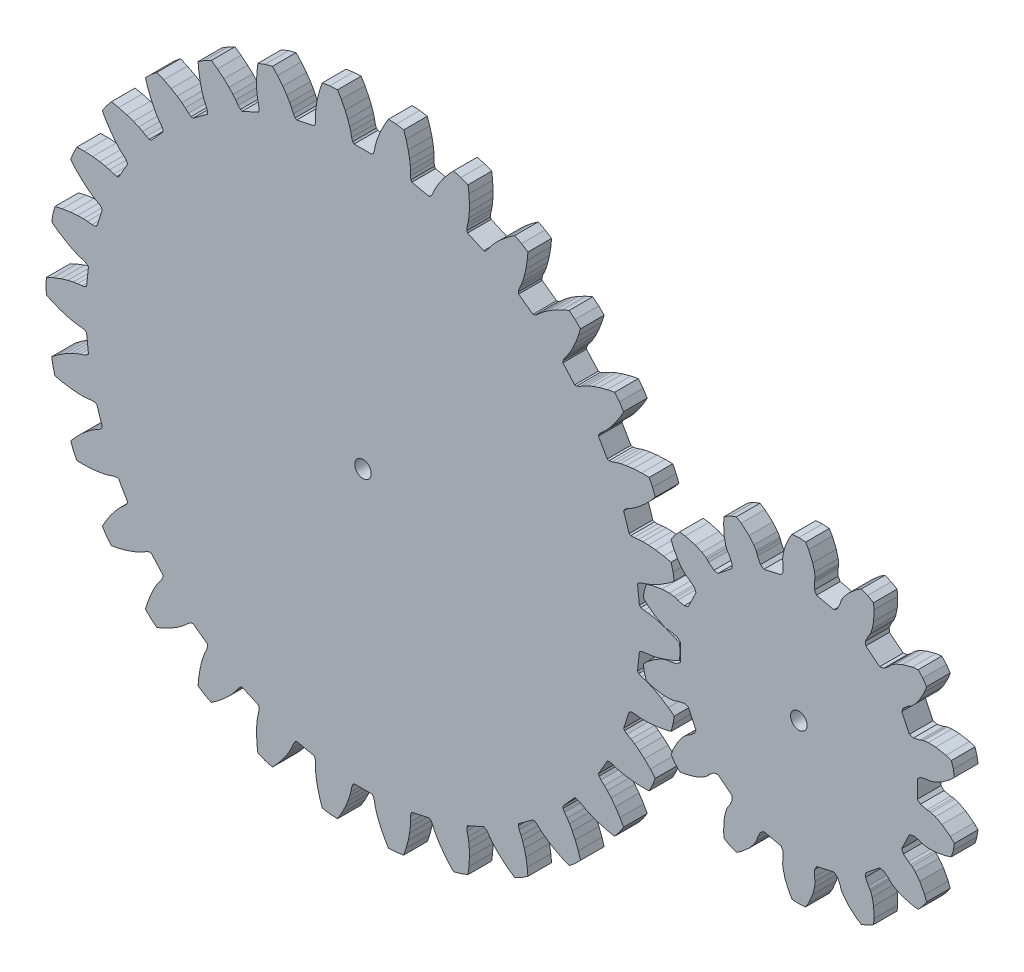
from build123d import *

# Parameters (mm, degrees)
MODEL_R             = 1.0795
BOSS_EXTRUDE1_DEPTH = 3.0988
MODEL_3_R           = 1.0795
BOSS_EXTRUDE2_DEPTH = 3.0988


with BuildPart() as part:
    # Model → Boss-Extrude1 (new body)
    with BuildSketch(Plane.XY):
        Polygon((39.441516503, -9.830019704), (40.395372889, -9.61187767), (40.655367359, -8.641565099), (40.81251227, -7.64939118), (40.02984746, -7.062140171), (39.103037375, -6.462979173), (38.294098274, -6.016757454), (37.619084961, -5.703688413), (37.091838369, -5.502545226), (36.525459945, -5.330663653), (36.159575727, -5.146889483), (35.996816225, -4.951285302), (36.239629524, -2.641071087), (36.439500736, -2.48358093), (36.835598304, -2.379894273), (37.42533619, -2.32952542), (37.982881199, -2.242398425), (38.708234565, -2.076513853), (39.592271118, -1.808231045), (40.623400754, -1.414857804), (41.511058811, -1.003164803), (41.563632451, 0), (41.511058811, 1.003164803), (40.623400754, 1.414857804), (39.592271118, 1.808231045), (38.708234565, 2.076513853), (37.982881199, 2.242398425), (37.42533619, 2.32952542), (36.835598304, 2.379894273), (36.439500736, 2.48358093), (36.239629524, 2.641071087), (35.996816225, 4.951285302), (36.159575727, 5.146889483), (36.525459945, 5.330663653), (37.091838369, 5.502545226), (37.619084961, 5.703688413), (38.294098274, 6.016757454), (39.103037375, 6.462979173), (40.02984746, 7.062140171), (40.81251227, 7.64939118), (40.655367359, 8.641565099), (40.395372889, 9.61187767), (39.441516503, 9.830019704), (38.351132627, 10.00041289), (37.430635262, 10.07903154), (36.686643265, 10.090481691), (36.123167232, 10.059784627), (35.535844261, 9.986439399), (35.126844706, 10.005506938), (34.898597115, 10.117999996), (34.180769326, 12.327246764), (34.299303746, 12.552416128), (34.618983718, 12.808245998), (35.137249226, 13.094128242), (35.611154195, 13.400496698), (36.206326134, 13.847067588), (36.904813263, 14.451726188), (37.686797747, 15.230488733), (38.330263103, 15.967632062), (37.970267628, 16.905452337), (37.514215334, 17.800505361), (36.53584872, 17.815562573), (35.433865612, 17.755528704), (34.517137586, 17.641047184), (33.78702298, 17.497562488), (33.242242528, 17.350382973), (32.683003303, 17.156529202), (32.278977006, 17.090144282), (32.03232855, 17.152723753), (30.870858789, 19.16444839), (30.939987605, 19.409341954), (31.199491782, 19.726046531), (31.646993684, 20.113435021), (32.046845109, 20.511638974), (32.536163804, 21.072194423), (33.093671721, 21.808863422), (33.696654131, 22.733191853), (34.17279751, 23.588010802), (33.625685, 24.430490186), (32.993506556, 25.21116555), (32.033389028, 25.022479869), (30.967968639, 24.734642713), (30.095075366, 24.432064416), (29.410747661, 24.139915842), (28.908472311, 23.882686328), (28.401758271, 23.576796354), (28.020363119, 23.427860313), (27.766093519, 23.437791175), (26.211743589, 25.16407166), (26.22844554, 25.417986401), (26.416432343, 25.781724175), (26.773612659, 26.253688174), (27.081935114, 26.726324202), (27.44401499, 27.376365247), (27.836177925, 28.212848674), (28.233805035, 29.242345404), (28.521816685, 30.177480282), (27.811498584, 30.887798384), (27.03082322, 31.519976829), (26.130916523, 31.135794724), (25.148622835, 30.632734146), (24.357713941, 30.155283194), (23.749081542, 29.727239037), (23.311263136, 29.371201688), (22.879220115, 28.966644371), (22.537124906, 28.741666428), (22.286346965, 28.698514655), (20.407049416, 30.063904248), (20.370594546, 30.315742874), (20.478848051, 30.710616759), (20.730096287, 31.246529176), (20.9334146, 31.772940815), (21.15243103, 32.484057542), (21.36210958, 33.383797059), (21.537003178, 34.473468139), (21.624295609, 35.448049067), (20.781816225, 35.995161576), (19.886763202, 36.45121387), (19.086397576, 35.888325943), (18.230161538, 35.192028104), (17.555803534, 34.560571395), (17.049466598, 34.015339239), (16.695239903, 33.576054595), (16.356750254, 33.090511031), (16.06890619, 32.799323804), (15.832580107, 32.704975335), (13.71046926, 33.649799957), (13.622450821, 33.888555911), (13.64623983, 34.297308024), (13.780575233, 34.873746914), (13.87000342, 35.43092745), (13.936384334, 36.172040648), (13.95441454, 37.095713319), (13.898930936, 38.197934895), (13.78168905, 39.169368008), (12.843868775, 39.529363483), (11.873556204, 39.789357953), (11.207711469, 39.072365107), (10.514954703, 38.213261564), (9.986620272, 37.455396787), (9.604708152, 36.816805893), (9.349554572, 36.313472801), (9.119411918, 35.768163574), (8.898399167, 35.42349334), (8.686853526, 35.282071656), (6.414675807, 35.765037939), (6.278940628, 35.98027644), (6.217225447, 36.385042352), (6.228776915, 36.97681457), (6.200406534, 37.54041254), (6.111250768, 38.279132004), (5.936844624, 39.186368902), (5.653408718, 40.252968602), (5.336756548, 41.178797612), (4.344582628, 41.335942523), (3.341417825, 41.388516163), (2.839194589, 40.548754426), (2.340193891, 39.564392126), (1.980973782, 38.713241608), (1.740177871, 38.009201463), (1.595248843, 37.463817994), (1.483511521, 36.882575734), (1.338989401, 36.499486236), (1.16146976, 36.317172143), (-1.16146976, 36.317172143), (-1.338989401, 36.499486236), (-1.483511521, 36.882575734), (-1.595248843, 37.463817994), (-1.740177871, 38.009201463), (-1.980973782, 38.713241608), (-2.340193891, 39.564392126), (-2.839194589, 40.548754426), (-3.341417825, 41.388516163), (-4.344582628, 41.335942523), (-5.336756548, 41.178797612), (-5.653408718, 40.252968602), (-5.936844624, 39.186368902), (-6.111250768, 38.279132004), (-6.200406534, 37.54041254), (-6.228776915, 36.97681457), (-6.217225447, 36.385042352), (-6.278940628, 35.98027644), (-6.414675807, 35.765037939), (-8.686853526, 35.282071656), (-8.898399167, 35.42349334), (-9.119411918, 35.768163574), (-9.349554572, 36.313472801), (-9.604708152, 36.816805893), (-9.986620272, 37.455396787), (-10.514954703, 38.213261564), (-11.207711469, 39.072365107), (-11.873556204, 39.789357953), (-12.843868775, 39.529363483), (-13.78168905, 39.169368008), (-13.898930936, 38.197934895), (-13.95441454, 37.095713319), (-13.936384334, 36.172040648), (-13.87000342, 35.43092745), (-13.780575233, 34.873746914), (-13.64623983, 34.297308024), (-13.622450821, 33.888555911), (-13.71046926, 33.649799957), (-15.832580107, 32.704975335), (-16.06890619, 32.799323804), (-16.356750254, 33.090511031), (-16.695239903, 33.576054595), (-17.049466598, 34.015339239), (-17.555803534, 34.560571395), (-18.230161538, 35.192028104), (-19.086397576, 35.888325943), (-19.886763202, 36.45121387), (-20.781816225, 35.995161576), (-21.624295609, 35.448049067), (-21.537003178, 34.473468139), (-21.36210958, 33.383797059), (-21.15243103, 32.484057542), (-20.9334146, 31.772940815), (-20.730096287, 31.246529176), (-20.478848051, 30.710616759), (-20.370594546, 30.315742874), (-20.407049416, 30.063904248), (-22.286346965, 28.698514655), (-22.537124906, 28.741666428), (-22.879220115, 28.966644371), (-23.311263136, 29.371201688), (-23.749081542, 29.727239037), (-24.357713941, 30.155283194), (-25.148622835, 30.632734146), (-26.130916523, 31.135794724), (-27.03082322, 31.519976829), (-27.811498584, 30.887798384), (-28.521816685, 30.177480282), (-28.233805035, 29.242345404), (-27.836177925, 28.212848674), (-27.44401499, 27.376365247), (-27.081935114, 26.726324202), (-26.773612659, 26.253688174), (-26.416432343, 25.781724175), (-26.22844554, 25.417986401), (-26.211743589, 25.16407166), (-27.766093519, 23.437791175), (-28.020363119, 23.427860313), (-28.401758271, 23.576796354), (-28.908472311, 23.882686328), (-29.410747661, 24.139915842), (-30.095075366, 24.432064416), (-30.967968639, 24.734642713), (-32.033389028, 25.022479869), (-32.993506556, 25.21116555), (-33.625685, 24.430490186), (-34.17279751, 23.588010802), (-33.696654131, 22.733191853), (-33.093671721, 21.808863422), (-32.536163804, 21.072194423), (-32.046845109, 20.511638974), (-31.646993684, 20.113435021), (-31.199491782, 19.726046531), (-30.939987605, 19.409341954), (-30.870858789, 19.16444839), (-32.03232855, 17.152723753), (-32.278977006, 17.090144282), (-32.683003303, 17.156529202), (-33.242242528, 17.350382973), (-33.78702298, 17.497562488), (-34.517137586, 17.641047184), (-35.433865612, 17.755528704), (-36.53584872, 17.815562573), (-37.514215334, 17.800505361), (-37.970267628, 16.905452337), (-38.330263103, 15.967632062), (-37.686797747, 15.230488733), (-36.904813263, 14.451726188), (-36.206326134, 13.847067588), (-35.611154195, 13.400496698), (-35.137249226, 13.094128242), (-34.618983718, 12.808245998), (-34.299303746, 12.552416128), (-34.180769326, 12.327246764), (-34.898597115, 10.117999996), (-35.126844706, 10.005506938), (-35.535844261, 9.986439399), (-36.123167232, 10.059784627), (-36.686643265, 10.090481691), (-37.430635262, 10.07903154), (-38.351132627, 10.00041289), (-39.441516503, 9.830019704), (-40.395372889, 9.61187767), (-40.655367359, 8.641565099), (-40.81251227, 7.64939118), (-40.02984746, 7.062140171), (-39.103037375, 6.462979173), (-38.294098274, 6.016757454), (-37.619084961, 5.703688413), (-37.091838369, 5.502545226), (-36.525459945, 5.330663653), (-36.159575727, 5.146889483), (-35.996816225, 4.951285302), (-36.239629524, 2.641071087), (-36.439500736, 2.48358093), (-36.835598304, 2.379894273), (-37.42533619, 2.32952542), (-37.982881199, 2.242398425), (-38.708234565, 2.076513853), (-39.592271118, 1.808231045), (-40.623400754, 1.414857804), (-41.511058811, 1.003164803), (-41.563632451, 0), (-41.511058811, -1.003164803), (-40.623400754, -1.414857804), (-39.592271118, -1.808231045), (-38.708234565, -2.076513853), (-37.982881199, -2.242398425), (-37.42533619, -2.32952542), (-36.835598304, -2.379894273), (-36.439500736, -2.48358093), (-36.239629524, -2.641071087), (-35.996816225, -4.951285302), (-36.159575727, -5.146889483), (-36.525459945, -5.330663653), (-37.091838369, -5.502545226), (-37.619084961, -5.703688413), (-38.294098274, -6.016757454), (-39.103037375, -6.462979173), (-40.02984746, -7.062140171), (-40.81251227, -7.64939118), (-40.655367359, -8.641565099), (-40.395372889, -9.61187767), (-39.441516503, -9.830019704), (-38.351132627, -10.00041289), (-37.430635262, -10.07903154), (-36.686643265, -10.090481691), (-36.123167232, -10.059784627), (-35.535844261, -9.986439399), (-35.126844706, -10.005506938), (-34.898597115, -10.117999996), (-34.180769326, -12.327246764), (-34.299303746, -12.552416128), (-34.618983718, -12.808245998), (-35.137249226, -13.094128242), (-35.611154195, -13.400496698), (-36.206326134, -13.847067588), (-36.904813263, -14.451726188), (-37.686797747, -15.230488733), (-38.330263103, -15.967632062), (-37.970267628, -16.905452337), (-37.514215334, -17.800505361), (-36.53584872, -17.815562573), (-35.433865612, -17.755528704), (-34.517137586, -17.641047184), (-33.78702298, -17.497562488), (-33.242242528, -17.350382973), (-32.683003303, -17.156529202), (-32.278977006, -17.090144282), (-32.03232855, -17.152723753), (-30.870858789, -19.16444839), (-30.939987605, -19.409341954), (-31.199491782, -19.726046531), (-31.646993684, -20.113435021), (-32.046845109, -20.511638974), (-32.536163804, -21.072194423), (-33.093671721, -21.808863422), (-33.696654131, -22.733191853), (-34.17279751, -23.588010802), (-33.625685, -24.430490186), (-32.993506556, -25.21116555), (-32.033389028, -25.022479869), (-30.967968639, -24.734642713), (-30.095075366, -24.432064416), (-29.410747661, -24.139915842), (-28.908472311, -23.882686328), (-28.401758271, -23.576796354), (-28.020363119, -23.427860313), (-27.766093519, -23.437791175), (-26.211743589, -25.16407166), (-26.22844554, -25.417986401), (-26.416432343, -25.781724175), (-26.773612659, -26.253688174), (-27.081935114, -26.726324202), (-27.44401499, -27.376365247), (-27.836177925, -28.212848674), (-28.233805035, -29.242345404), (-28.521816685, -30.177480282), (-27.811498584, -30.887798384), (-27.03082322, -31.519976829), (-26.130916523, -31.135794724), (-25.148622835, -30.632734146), (-24.357713941, -30.155283194), (-23.749081542, -29.727239037), (-23.311263136, -29.371201688), (-22.879220115, -28.966644371), (-22.537124906, -28.741666428), (-22.286346965, -28.698514655), (-20.407049416, -30.063904248), (-20.370594546, -30.315742874), (-20.478848051, -30.710616759), (-20.730096287, -31.246529176), (-20.9334146, -31.772940815), (-21.15243103, -32.484057542), (-21.36210958, -33.383797059), (-21.537003178, -34.473468139), (-21.624295609, -35.448049067), (-20.781816225, -35.995161576), (-19.886763202, -36.45121387), (-19.086397576, -35.888325943), (-18.230161538, -35.192028104), (-17.555803534, -34.560571395), (-17.049466598, -34.015339239), (-16.695239903, -33.576054595), (-16.356750254, -33.090511031), (-16.06890619, -32.799323804), (-15.832580107, -32.704975335), (-13.71046926, -33.649799957), (-13.622450821, -33.888555911), (-13.64623983, -34.297308024), (-13.780575233, -34.873746914), (-13.87000342, -35.43092745), (-13.936384334, -36.172040648), (-13.95441454, -37.095713319), (-13.898930936, -38.197934895), (-13.78168905, -39.169368008), (-12.843868775, -39.529363483), (-11.873556204, -39.789357953), (-11.207711469, -39.072365107), (-10.514954703, -38.213261564), (-9.986620272, -37.455396787), (-9.604708152, -36.816805893), (-9.349554572, -36.313472801), (-9.119411918, -35.768163574), (-8.898399167, -35.42349334), (-8.686853526, -35.282071656), (-6.414675807, -35.765037939), (-6.278940628, -35.98027644), (-6.217225447, -36.385042352), (-6.228776915, -36.97681457), (-6.200406534, -37.54041254), (-6.111250768, -38.279132004), (-5.936844624, -39.186368902), (-5.653408718, -40.252968602), (-5.336756548, -41.178797612), (-4.344582628, -41.335942523), (-3.341417825, -41.388516163), (-2.839194589, -40.548754426), (-2.340193891, -39.564392126), (-1.980973782, -38.713241608), (-1.740177871, -38.009201463), (-1.595248843, -37.463817994), (-1.483511521, -36.882575734), (-1.338989401, -36.499486236), (-1.16146976, -36.317172143), (1.16146976, -36.317172143), (1.338989401, -36.499486236), (1.483511521, -36.882575734), (1.595248843, -37.463817994), (1.740177871, -38.009201463), (1.980973782, -38.713241608), (2.340193891, -39.564392126), (2.839194589, -40.548754426), (3.341417825, -41.388516163), (4.344582628, -41.335942523), (5.336756548, -41.178797612), (5.653408718, -40.252968602), (5.936844624, -39.186368902), (6.111250768, -38.279132004), (6.200406534, -37.54041254), (6.228776915, -36.97681457), (6.217225447, -36.385042352), (6.278940628, -35.98027644), (6.414675807, -35.765037939), (8.686853526, -35.282071656), (8.898399167, -35.42349334), (9.119411918, -35.768163574), (9.349554572, -36.313472801), (9.604708152, -36.816805893), (9.986620272, -37.455396787), (10.514954703, -38.213261564), (11.207711469, -39.072365107), (11.873556204, -39.789357953), (12.843868775, -39.529363483), (13.78168905, -39.169368008), (13.898930936, -38.197934895), (13.95441454, -37.095713319), (13.936384334, -36.172040648), (13.87000342, -35.43092745), (13.780575233, -34.873746914), (13.64623983, -34.297308024), (13.622450821, -33.888555911), (13.71046926, -33.649799957), (15.832580107, -32.704975335), (16.06890619, -32.799323804), (16.356750254, -33.090511031), (16.695239903, -33.576054595), (17.049466598, -34.015339239), (17.555803534, -34.560571395), (18.230161538, -35.192028104), (19.086397576, -35.888325943), (19.886763202, -36.45121387), (20.781816225, -35.995161576), (21.624295609, -35.448049067), (21.537003178, -34.473468139), (21.36210958, -33.383797059), (21.15243103, -32.484057542), (20.9334146, -31.772940815), (20.730096287, -31.246529176), (20.478848051, -30.710616759), (20.370594546, -30.315742874), (20.407049416, -30.063904248), (22.286346965, -28.698514655), (22.537124906, -28.741666428), (22.879220115, -28.966644371), (23.311263136, -29.371201688), (23.749081542, -29.727239037), (24.357713941, -30.155283194), (25.148622835, -30.632734146), (26.130916523, -31.135794724), (27.03082322, -31.519976829), (27.811498584, -30.887798384), (28.521816685, -30.177480282), (28.233805035, -29.242345404), (27.836177925, -28.212848674), (27.44401499, -27.376365247), (27.081935114, -26.726324202), (26.773612659, -26.253688174), (26.416432343, -25.781724175), (26.22844554, -25.417986401), (26.211743589, -25.16407166), (27.766093519, -23.437791175), (28.020363119, -23.427860313), (28.401758271, -23.576796354), (28.908472311, -23.882686328), (29.410747661, -24.139915842), (30.095075366, -24.432064416), (30.967968639, -24.734642713), (32.033389028, -25.022479869), (32.993506556, -25.21116555), (33.625685, -24.430490186), (34.17279751, -23.588010802), (33.696654131, -22.733191853), (33.093671721, -21.808863422), (32.536163804, -21.072194423), (32.046845109, -20.511638974), (31.646993684, -20.113435021), (31.199491782, -19.726046531), (30.939987605, -19.409341954), (30.870858789, -19.16444839), (32.03232855, -17.152723753), (32.278977006, -17.090144282), (32.683003303, -17.156529202), (33.242242528, -17.350382973), (33.78702298, -17.497562488), (34.517137586, -17.641047184), (35.433865612, -17.755528704), (36.53584872, -17.815562573), (37.514215334, -17.800505361), (37.970267628, -16.905452337), (38.330263103, -15.967632062), (37.686797747, -15.230488733), (36.904813263, -14.451726188), (36.206326134, -13.847067588), (35.611154195, -13.400496698), (35.137249226, -13.094128242), (34.618983718, -12.808245998), (34.299303746, -12.552416128), (34.180769326, -12.327246764), (34.898597115, -10.117999996), (35.126844706, -10.005506938), (35.535844261, -9.986439399), (36.123167232, -10.059784627), (36.686643265, -10.090481691), (37.430635262, -10.07903154), (38.351132627, -10.00041289), align=None)
        Circle(MODEL_R, mode=Mode.SUBTRACT)
    extrude(amount=BOSS_EXTRUDE1_DEPTH)


with BuildPart() as body_2:
    # Model<3> → Boss-Extrude2 (new body)
    with BuildSketch(Plane.XY):
        Polygon((37.865243537, 5.717161716), (37.150939025, 5.472855184), (36.889221916, 4.624389156), (36.75688527, 3.746392881), (37.294450767, 3.216355189), (38.394666802, 2.416280128), (39.259501367, 1.966974169), (39.816619893, 1.776428411), (40.016362931, 1.740091881), (40.358817073, 1.729695581), (41.209603054, 1.523021957), (41.614638701, 1.16146976), (41.614638701, -1.16146976), (41.209603054, -1.523021957), (40.358817073, -1.729695581), (40.016362931, -1.740091881), (39.816619893, -1.776428411), (39.259501367, -1.966974169), (38.394666802, -2.416280128), (37.294450767, -3.216355189), (36.75688527, -3.746392881), (36.889221916, -4.624389156), (37.150939025, -5.472855184), (37.865243537, -5.717161716), (39.203643491, -5.96063859), (40.177779061, -5.990211617), (40.762400214, -5.920162743), (40.958128303, -5.86623557), (41.271179608, -5.727017029), (42.127383615, -5.544081327), (42.649179743, -5.694090219), (43.657065428, -7.786986409), (43.449012538, -8.288472064), (42.772153181, -8.843820767), (42.468123446, -9.001772793), (42.303927017, -9.121176132), (41.884655275, -9.534576597), (41.300412805, -10.314624934), (40.656291969, -11.512833502), (40.401936927, -12.223621889), (40.902116432, -12.957250481), (41.506051012, -13.60813716), (42.255617772, -13.518324626), (43.56711512, -13.156979733), (44.457612196, -12.760962526), (44.953944588, -12.444193061), (45.106891379, -12.310683121), (45.328536198, -12.049423679), (46.020576526, -11.51311131), (46.555785012, -11.421865797), (48.371932261, -12.870194899), (48.402069555, -13.412288627), (48.033197118, -14.206318789), (47.827808608, -14.480542204), (47.731679904, -14.659363056), (47.533296857, -15.213739196), (47.345362869, -16.17003177), (47.284913262, -17.529053945), (47.364146812, -18.27981267), (48.13310249, -18.723769437), (48.959637891, -19.048160678), (49.596006008, -18.642017553), (50.620842616, -17.747419681), (51.251327332, -17.004248305), (51.561066245, -16.503498324), (51.64093875, -16.316848899), (51.727277608, -15.985294192), (52.118087184, -15.2018284), (52.560703423, -14.887400774), (54.825402, -15.404303446), (55.087760418, -15.879636937), (55.099934611, -16.755081145), (55.033867038, -17.09126264), (55.024845529, -17.294083342), (55.086643372, -17.879634163), (55.332240498, -18.822765503), (55.867434906, -20.073430274), (56.26456387, -20.715462364), (57.149994619, -20.781816225), (58.035425368, -20.715462364), (58.432554333, -20.073430274), (58.967748741, -18.822765503), (59.213345867, -17.879634163), (59.27514371, -17.294083342), (59.266122201, -17.09126264), (59.200054628, -16.755081145), (59.212228821, -15.879636937), (59.474587239, -15.404303446), (61.739285816, -14.887400774), (62.181902055, -15.2018284), (62.572711631, -15.985294192), (62.659050489, -16.316848899), (62.738922994, -16.503498324), (63.048661907, -17.004248305), (63.679146623, -17.747419681), (64.703983231, -18.642017553), (65.340351348, -19.048160678), (66.166886749, -18.723769437), (66.935842427, -18.27981267), (67.015075977, -17.529053945), (66.95462637, -16.17003177), (66.766692382, -15.213739196), (66.568309335, -14.659363056), (66.472180631, -14.480542204), (66.266792121, -14.206318789), (65.897919683, -13.412288627), (65.928056978, -12.870194899), (67.744204227, -11.421865797), (68.279412713, -11.51311131), (68.971453041, -12.049423679), (69.19309786, -12.310683121), (69.346044651, -12.444193061), (69.842377043, -12.760962526), (70.732874119, -13.156979733), (72.044371467, -13.518324626), (72.793938227, -13.60813716), (73.397872807, -12.957250481), (73.898052312, -12.223621889), (73.64369727, -11.512833502), (72.999576434, -10.314624934), (72.415333964, -9.534576597), (71.996062222, -9.121176132), (71.831865793, -9.001772793), (71.527836058, -8.843820767), (70.8509767, -8.288472064), (70.642923811, -7.786986409), (71.650809496, -5.694090219), (72.172605624, -5.544081327), (73.02880963, -5.727017029), (73.341860936, -5.86623557), (73.537589025, -5.920162743), (74.122210178, -5.990211617), (75.096345747, -5.96063859), (76.434745702, -5.717161716), (77.149050214, -5.472855184), (77.410767323, -4.624389156), (77.543103969, -3.746392881), (77.005538472, -3.216355189), (75.905322437, -2.416280128), (75.040487871, -1.966974169), (74.483369346, -1.776428411), (74.283626307, -1.740091881), (73.941172166, -1.729695581), (73.090386185, -1.523021957), (72.685350537, -1.16146976), (72.685350537, 1.16146976), (73.090386185, 1.523021957), (73.941172166, 1.729695581), (74.283626307, 1.740091881), (74.483369346, 1.776428411), (75.040487871, 1.966974169), (75.905322437, 2.416280128), (77.005538472, 3.216355189), (77.543103969, 3.746392881), (77.410767323, 4.624389156), (77.149050214, 5.472855184), (76.434745702, 5.717161716), (75.096345747, 5.96063859), (74.122210178, 5.990211617), (73.537589025, 5.920162743), (73.341860936, 5.86623557), (73.02880963, 5.727017029), (72.172605624, 5.544081327), (71.650809496, 5.694090219), (70.642923811, 7.786986409), (70.8509767, 8.288472064), (71.527836058, 8.843820767), (71.831865793, 9.001772793), (71.996062222, 9.121176132), (72.415333964, 9.534576597), (72.999576434, 10.314624934), (73.64369727, 11.512833502), (73.898052312, 12.223621889), (73.397872807, 12.957250481), (72.793938227, 13.60813716), (72.044371467, 13.518324626), (70.732874119, 13.156979733), (69.842377043, 12.760962526), (69.346044651, 12.444193061), (69.19309786, 12.310683121), (68.971453041, 12.049423679), (68.279412713, 11.51311131), (67.744204227, 11.421865797), (65.928056978, 12.870194899), (65.897919683, 13.412288627), (66.266792121, 14.206318789), (66.472180631, 14.480542204), (66.568309335, 14.659363056), (66.766692382, 15.213739196), (66.95462637, 16.17003177), (67.015075977, 17.529053945), (66.935842427, 18.27981267), (66.166886749, 18.723769437), (65.340351348, 19.048160678), (64.703983231, 18.642017553), (63.679146623, 17.747419681), (63.048661907, 17.004248305), (62.738922994, 16.503498324), (62.659050489, 16.316848899), (62.572711631, 15.985294192), (62.181902055, 15.2018284), (61.739285816, 14.887400774), (59.474587239, 15.404303446), (59.212228821, 15.879636937), (59.200054628, 16.755081145), (59.266122201, 17.09126264), (59.27514371, 17.294083342), (59.213345867, 17.879634163), (58.967748741, 18.822765503), (58.432554333, 20.073430274), (58.035425368, 20.715462364), (57.149994619, 20.781816225), (56.26456387, 20.715462364), (55.867434906, 20.073430274), (55.332240498, 18.822765503), (55.086643372, 17.879634163), (55.024845529, 17.294083342), (55.033867038, 17.09126264), (55.099934611, 16.755081145), (55.087760418, 15.879636937), (54.825402, 15.404303446), (52.560703423, 14.887400774), (52.118087184, 15.2018284), (51.727277608, 15.985294192), (51.64093875, 16.316848899), (51.561066245, 16.503498324), (51.251327332, 17.004248305), (50.620842616, 17.747419681), (49.596006008, 18.642017553), (48.959637891, 19.048160678), (48.13310249, 18.723769437), (47.364146812, 18.27981267), (47.284913262, 17.529053945), (47.345362869, 16.17003177), (47.533296857, 15.213739196), (47.731679904, 14.659363056), (47.827808608, 14.480542204), (48.033197118, 14.206318789), (48.402069555, 13.412288627), (48.371932261, 12.870194899), (46.555785012, 11.421865797), (46.020576526, 11.51311131), (45.328536198, 12.049423679), (45.106891379, 12.310683121), (44.953944588, 12.444193061), (44.457612196, 12.760962526), (43.56711512, 13.156979733), (42.255617772, 13.518324626), (41.506051012, 13.60813716), (40.902116432, 12.957250481), (40.401936927, 12.223621889), (40.656291969, 11.512833502), (41.300412805, 10.314624934), (41.884655275, 9.534576597), (42.303927017, 9.121176132), (42.468123446, 9.001772793), (42.772153181, 8.843820767), (43.449012538, 8.288472064), (43.657065428, 7.786986409), (42.649179743, 5.694090219), (42.127383615, 5.544081327), (41.271179608, 5.727017029), (40.958128303, 5.86623557), (40.762400214, 5.920162743), (40.177779061, 5.990211617), (39.203643491, 5.96063859), align=None)
        with Locations((57.149994619, 0)):
            Circle(MODEL_3_R, mode=Mode.SUBTRACT)
    extrude(amount=BOSS_EXTRUDE2_DEPTH)


solid = Compound([part.part, body_2.part])
